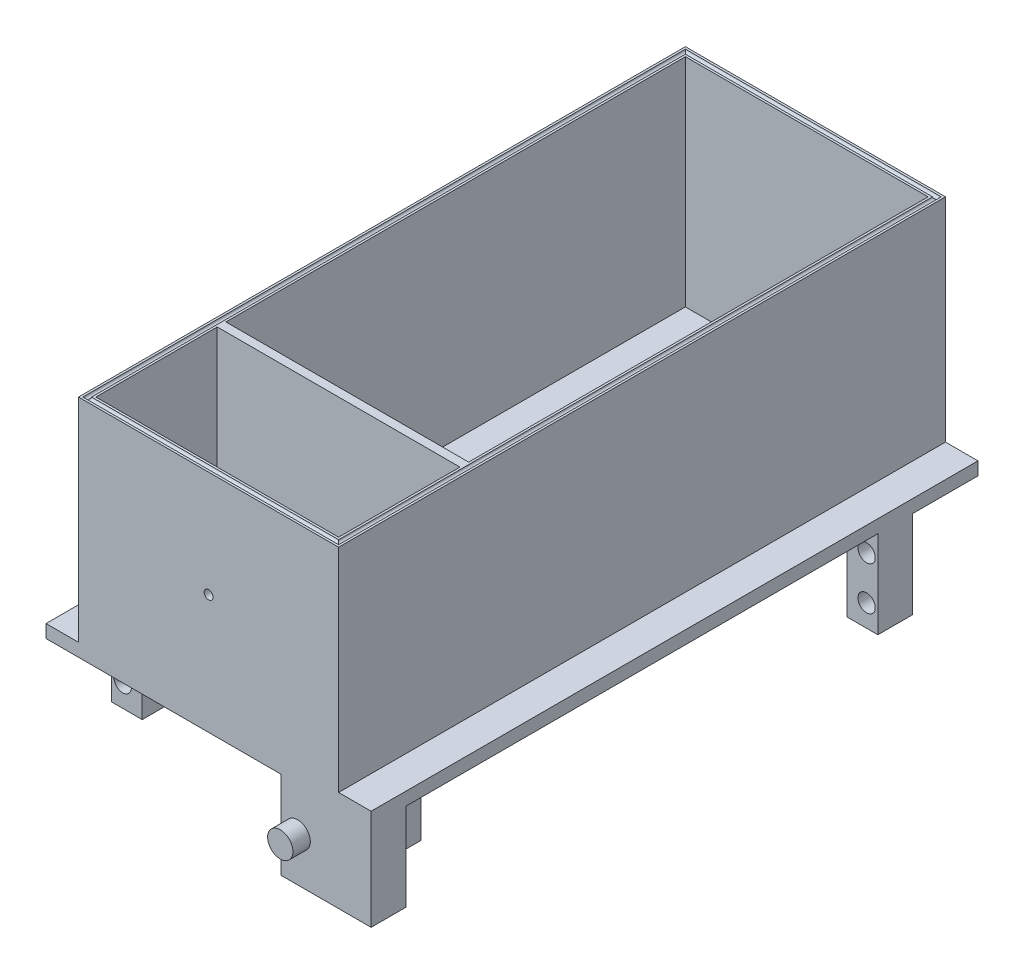
from build123d import *

# Parameters (mm, degrees)
SKETCH1_W            = 60
SKETCH1_H            = 110
BOSS_EXTRUDE1_DEPTH  = 2
SKETCH2_W            = 60
SKETCH2_H            = 110
SKETCH2_W_2          = 56
SKETCH2_H_2          = 106
BOSS_EXTRUDE2_DEPTH  = 50
SKETCH3_W            = 60
SKETCH3_H            = 30
BOSS_EXTRUDE3_DEPTH  = 2
BOSS_EXTRUDE4_DEPTH  = 50
SKETCH5_R            = 2.486759959
CUT_EXTRUDE1_DEPTH   = 30
CUT_SWEEP1_PROFILE_R = 0.5
SKETCH43_W           = 7.5
SKETCH43_H           = 140
BOSS_EXTRUDE7_DEPTH  = 3
SKETCH55_W           = 7.1
SKETCH55_H           = 8
BOSS_EXTRUDE10_DEPTH = 20.2
SKETCH56_R           = 2
CUT_EXTRUDE3_DEPTH   = 46.2
SKETCH59_R           = 2
CUT_EXTRUDE4_DEPTH   = 49.2
SKETCH60_R           = 2.925
BOSS_EXTRUDE11_DEPTH = 4
SKETCH61_R           = 2.925
BOSS_EXTRUDE12_DEPTH = 4
SKETCH62_R           = 1.025
CUT_EXTRUDE5_DEPTH   = 10


with BuildPart() as part:
    # Sketch1 → Boss-Extrude1 (new body)
    with BuildSketch(Plane(origin=(0, 0, 0), x_dir=(1, 0, 0), z_dir=(0, 1, 0))):
        Rectangle(SKETCH1_W, SKETCH1_H)
    extrude(amount=BOSS_EXTRUDE1_DEPTH)

    # Sketch2 → Boss-Extrude2 (add)
    with BuildSketch(Plane(origin=(0, 2, 0), x_dir=(1, 0, 0), z_dir=(0, 1, 0))):
        Rectangle(SKETCH2_W, SKETCH2_H)
        Rectangle(SKETCH2_W_2, SKETCH2_H_2, mode=Mode.SUBTRACT)
    extrude(amount=BOSS_EXTRUDE2_DEPTH)

    # Sketch3 → Boss-Extrude3 (add)
    with BuildSketch(Plane(origin=(0, 0, 0), x_dir=(1, 0, 0), z_dir=(0, 1, 0))):
        with Locations((0, -70)):
            Rectangle(SKETCH3_W, SKETCH3_H)
    extrude(amount=BOSS_EXTRUDE3_DEPTH)

    # Sketch4 → Boss-Extrude4 (add)
    with BuildSketch(Plane(origin=(0, 2, 0), x_dir=(1, 0, 0), z_dir=(0, 1, 0))):
        Polygon((-28, -55), (-30, -55), (-30, -85), (30, -85), (30, -55), (28, -55), (28, -83), (-28, -83), align=None)
    extrude(amount=BOSS_EXTRUDE4_DEPTH)

    # Sketch5 → Cut-Extrude1 (cut)
    with BuildSketch(Plane.XY.offset(55)):
        with Locations((0, 15.890944925)):
            Circle(SKETCH5_R)
    extrude(amount=-CUT_EXTRUDE1_DEPTH, mode=Mode.SUBTRACT)

    # Cut-Sweep1: sweep along a path in Sketch6
    with BuildLine(Plane(origin=(0, 52, 0), x_dir=(1, 0, 0), z_dir=(0, 1, 0))) as cut_sweep1_path:
        Line((-29, 54), (-29, -84))
        Line((-29, -84), (29, -84))
        Line((29, -84), (29, 54))
        Line((29, 54), (-29, 54))
    # Cut-Sweep1 profile (on start of the path) → Cut-Sweep1 (sweep, cut)
    with BuildSketch(Plane(origin=(-29, 52, -54), x_dir=(1, 0, 0), z_dir=(0, 0, 1))):
        Circle(CUT_SWEEP1_PROFILE_R)
    sweep(path=cut_sweep1_path.line, transition=Transition.RIGHT, mode=Mode.SUBTRACT)

    # Sketch43 → Boss-Extrude7 (add)
    with BuildSketch(Plane.XZ):
        with Locations((33.75, 15)):
            Rectangle(SKETCH43_W, SKETCH43_H)
        Polygon((-30, -55), (-37.5, -55), (-37.5, 85), (-30, 85), (-30, 55), align=None)
    extrude(amount=-BOSS_EXTRUDE7_DEPTH)

    # Sketch55 → Boss-Extrude10 (add)
    with BuildSketch(Plane.XZ):
        with Locations((-33.95, 65.9)):
            Rectangle(SKETCH55_W, SKETCH55_H)
        Polygon((9.6, 69.9), (9.6, 61.9), (25.881976889, 61.9), (25.881976889, 77), (37.5, 77), (37.5, 85), (16.7, 85), (16.7, 69.9), align=None)
        with Locations((33.95, -35.9)):
            Rectangle(SKETCH55_W, SKETCH55_H)
        Polygon((-9.6, -39.9), (-9.6, -31.9), (-24.7, -31.9), (-24.7, -47), (-37.5, -47), (-37.5, -55), (-16.7, -55), (-16.7, -39.9), align=None)
    extrude(amount=BOSS_EXTRUDE10_DEPTH)

    # Sketch56 → Cut-Extrude3 (cut)
    with BuildSketch(Plane.XY.offset(85)):
        with Locations((-34.9, -15.1)):
            Circle(SKETCH56_R)
        with Locations((-34.9, -5.1)):
            Circle(SKETCH56_R)
        with Locations((14.1, -15.1)):
            Circle(SKETCH56_R)
        with Locations((14.1, -5.1)):
            Circle(SKETCH56_R)
    extrude(amount=-CUT_EXTRUDE3_DEPTH, mode=Mode.SUBTRACT)

    # Sketch59 → Cut-Extrude4 (cut)
    with BuildSketch(Plane(origin=(0, 0, -55), x_dir=(-1, 0, 0), z_dir=(0, 0, -1))):
        with Locations((-34.9, -15.1)):
            Circle(SKETCH59_R)
        with Locations((-34.9, -5.1)):
            Circle(SKETCH59_R)
        with Locations((14.1, -5.1)):
            Circle(SKETCH59_R)
        with Locations((14.1, -15.1)):
            Circle(SKETCH59_R)
    extrude(amount=-CUT_EXTRUDE4_DEPTH, mode=Mode.SUBTRACT)

    # Sketch60 → Boss-Extrude11 (add)
    with BuildSketch(Plane(origin=(0, 0, -55), x_dir=(-1, 0, 0), z_dir=(0, 0, -1))):
        with Locations((20.55, -10.1)):
            Circle(SKETCH60_R)
    extrude(amount=BOSS_EXTRUDE11_DEPTH)

    # Sketch61 → Boss-Extrude12 (add)
    with BuildSketch(Plane.XY.offset(85)):
        with Locations((20.55, -10.1)):
            Circle(SKETCH61_R)
    extrude(amount=BOSS_EXTRUDE12_DEPTH)

    # Sketch62 → Cut-Extrude5 (cut)
    with BuildSketch(Plane.XY.offset(85)):
        with Locations((0, 27.5)):
            Circle(SKETCH62_R)
    extrude(amount=-CUT_EXTRUDE5_DEPTH, mode=Mode.SUBTRACT)


solid = part.part
